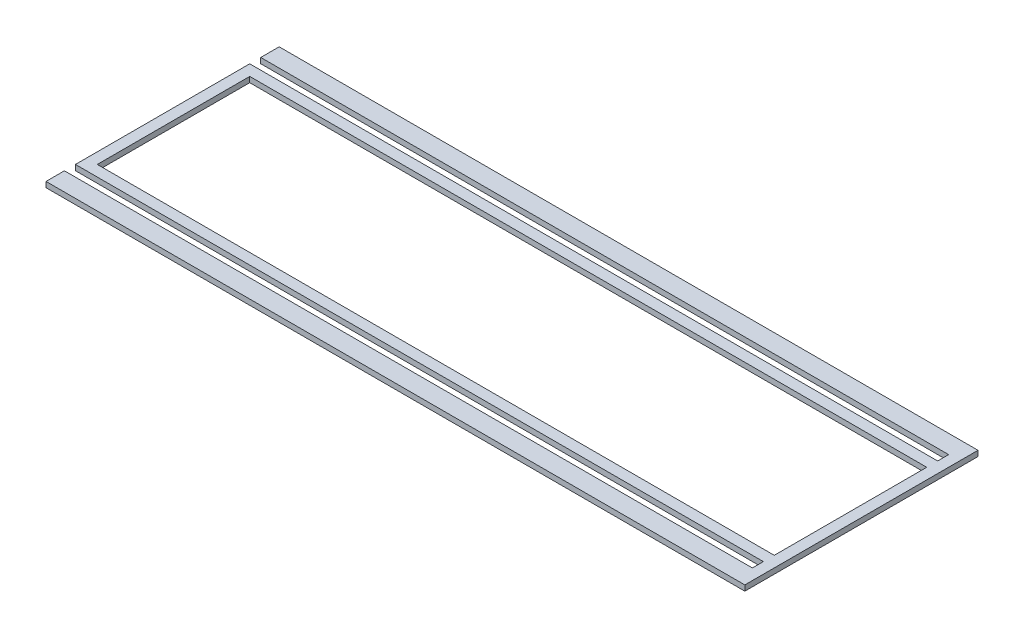
from build123d import *

# Parameters (mm, degrees)
SKETCH1_W           = 393.7
SKETCH1_H           = 88.6587
BOSS_EXTRUDE1_DEPTH = 1.5875


with BuildPart() as part:
    # Sketch1 → Boss-Extrude1 (new, symmetric)
    with BuildSketch(Plane(origin=(0, 0, 0), x_dir=(1, 0, 0), z_dir=(0, 1, 0))):
        Polygon((196.85, 50.67935), (-203.2, 50.67935), (-203.2, -50.67935), (196.85, -50.67935), (196.85, -57.08015), (-203.2, -57.08015), (-203.2, -67.795775), (190.5, -67.795775), (203.2, -67.795775), (203.2, 67.795775), (190.5, 67.795775), (-203.2, 67.795775), (-203.2, 57.08015), (196.85, 57.08015), align=None)
        Rectangle(SKETCH1_W, SKETCH1_H, mode=Mode.SUBTRACT)
    extrude(amount=BOSS_EXTRUDE1_DEPTH, both=True)


solid = part.part
